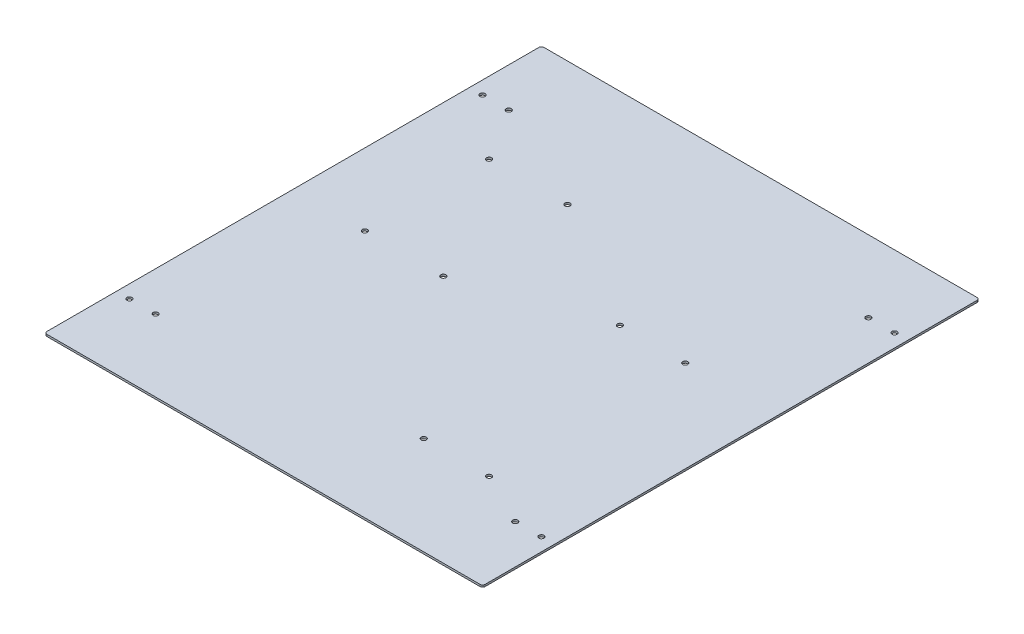
from build123d import *

# Parameters (mm, degrees)
SKETCH1_W           = 335
SKETCH1_H           = 380
BOSS_EXTRUDE1_DEPTH = 1.5
SKETCH12_R          = 1.95
CUT_EXTRUDE3_DEPTH  = 50.8
SKETCH6_R           = 1.95
CUT_EXTRUDE4_DEPTH  = 50.8
SKETCH7_R           = 1.95
CUT_EXTRUDE5_DEPTH  = 50.8
FILLET1_R           = 2


with BuildPart() as part:
    # Sketch1 → Boss-Extrude1 (new body)
    with BuildSketch(Plane(origin=(0, 0, 0), x_dir=(1, 0, 0), z_dir=(0, 1, 0))):
        Rectangle(SKETCH1_W, SKETCH1_H)
    extrude(amount=BOSS_EXTRUDE1_DEPTH)

    # Sketch12 → Cut-Extrude3 (cut)
    with BuildSketch(Plane(origin=(0, 0, 0), x_dir=(-1, 0, 0), z_dir=(0, -1, 0))):
        with Locations((-137.5, -135)):
            Circle(SKETCH12_R)
        with Locations((-157.5, 135)):
            Circle(SKETCH12_R)
        with Locations((-157.5, -135)):
            Circle(SKETCH12_R)
        with Locations((-137.5, 135)):
            Circle(SKETCH12_R)
        with Locations((157.5, -135)):
            Circle(SKETCH12_R)
        with Locations((137.5, 135)):
            Circle(SKETCH12_R)
        with Locations((157.5, 135)):
            Circle(SKETCH12_R)
        with Locations((137.5, -135)):
            Circle(SKETCH12_R)
    extrude(amount=-CUT_EXTRUDE3_DEPTH, mode=Mode.SUBTRACT)

    # Sketch6 → Cut-Extrude4 (cut)
    with BuildSketch(Plane(origin=(0, 1.5, 0), x_dir=(1, 0, 0), z_dir=(0, 1, 0))):
        with Locations((97.5, 35)):
            Circle(SKETCH6_R)
        with Locations((47.5, 35)):
            Circle(SKETCH6_R)
        with Locations((97.5, -115)):
            Circle(SKETCH6_R)
        with Locations((47.5, -115)):
            Circle(SKETCH6_R)
    extrude(amount=-CUT_EXTRUDE4_DEPTH, mode=Mode.SUBTRACT)

    # Sketch7 → Cut-Extrude5 (cut)
    with BuildSketch(Plane(origin=(0, 1.5, 0), x_dir=(1, 0, 0), z_dir=(0, 1, 0))):
        with Locations((-112.5, 95)):
            Circle(SKETCH7_R)
        with Locations((-52.5, 95)):
            Circle(SKETCH7_R)
        with Locations((-52.5, 0)):
            Circle(SKETCH7_R)
        with Locations((-112.5, 0)):
            Circle(SKETCH7_R)
    extrude(amount=-CUT_EXTRUDE5_DEPTH, mode=Mode.SUBTRACT)

    # Fillet1
    fillet1_edges = [part.edges().sort_by_distance(p)[0] for p in [
        (167.5, 0.75, -190),
        (167.5, 0.75, 190),
        (-167.5, 0.75, 190),
        (-167.5, 0.75, -190),
    ]]
    fillet(fillet1_edges, radius=FILLET1_R)


solid = part.part
